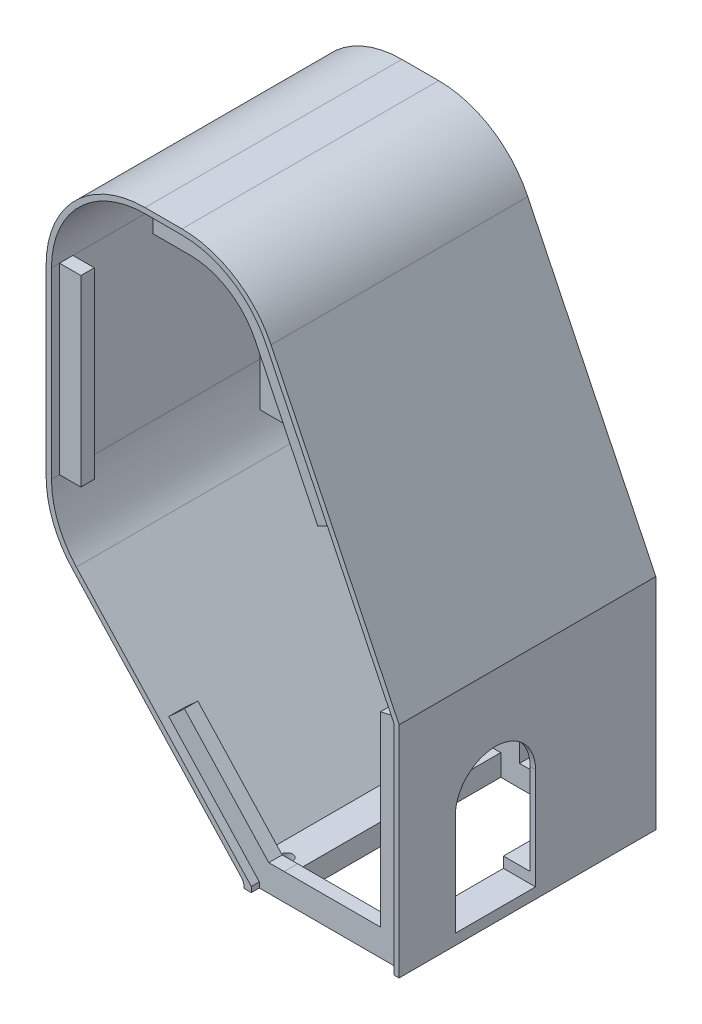
from build123d import *

# Parameters (mm, degrees)
EXTRUDE_1_DEPTH      = 6
FILLET_1_R           = 18.5
SKETCH_3_R           = 16.15
CUT_EXTRUDE_1_DEPTH  = 4.5
CUT_EXTRUDE_2_REACH  = 120.868
SKETCH_4_R           = 14.85
CHAMFER_1_SIZE       = 2.355852366
CHAMFER_1_SIZE_2     = 1
SKETCH_5_W           = 28
SKETCH_5_H           = 6
EXTRUDE_2_DEPTH      = 6.5
SKETCH_6_W           = 14.3
SKETCH_6_H           = 2.8
CUT_EXTRUDE_3_DEPTH  = 1.5
SKETCH_7_W           = 6.85
SKETCH_7_H           = 3
SKETCH_7_H_2         = 2.655811089
EXTRUDE_3_DEPTH      = 28
CUT_EXTRUDE_4_REACH  = 121.439
SKETCH_8_R           = 1.15
CUT_EXTRUDE_5_REACH  = 121.439
SKETCH_9_R           = 2.1
CUT_EXTRUDE_START    = -3
SKETCH_10_R          = 10.75
CUT_EXTRUDE_6_DEPTH  = 3
CUT_EXTRUDE_7_REACH  = 121.439
SKETCH_11_R          = 1.4
EXTRUDE_4_DEPTH      = 42
SKETCH_13_R          = 1.1
CUT_EXTRUDE_8_DEPTH  = 8
SKETCH_14_W          = 6
SKETCH_14_H          = 46
SKETCH_14_R          = 1.1
EXTRUDE_5_DEPTH      = 4
FILLET_2_R           = 2
CUT_EXTRUDE_10_REACH = 128.016
CUT_EXTRUDE_11_REACH = 130.115
EXTRUDE_START        = -1.5
SKETCH_17_W          = 5
SKETCH_17_H          = 34.255734548
EXTRUDE_6_DEPTH      = 2.5


with BuildPart() as part:
    # 스케치1 → 보스-돌출1 (new body)
    with BuildSketch(Plane.XY):
        Polygon((-65.949690405, 38.792569711), (-28.949690405, -1.207430289), (-28.949690405, -2.207430289), (0.050309595, -2.207430289), (0.050309595, -1.207430289), (0.050309595, 38.792569711), (-28.949690405, 98.792569711), (-65.949690405, 98.792569711), align=None)
    extrude(amount=-EXTRUDE_1_DEPTH)

    # 필렛1
    fillet_1_edges = [part.edges().sort_by_distance(p)[0] for p in [
        (-65.949690405, 98.792569711, -3),
        (-28.949690405, 98.792569711, -3),
        (-65.949690405, 38.792569711, -3),
    ]]
    fillet(fillet_1_edges, radius=FILLET_1_R)

    # 스케치3 → 컷-돌출1 (cut)
    with BuildSketch(Plane(origin=(0, 0, -6), x_dir=(-1, 0, 0), z_dir=(0, 0, -1))):
        with Locations((47.449690405, 80.292569711)):
            Circle(SKETCH_3_R)
    extrude(amount=-CUT_EXTRUDE_1_DEPTH, mode=Mode.SUBTRACT)

    # 스케치4 → 컷-돌출2 (cut, up to next)
    with BuildSketch(Plane(origin=(0, 0, -1.5), x_dir=(-1, 0, 0), z_dir=(0, 0, -1)), mode=Mode.PRIVATE) as cut_extrude_2_sk1:
        with Locations((47.449690405, 80.292569711)):
            Circle(SKETCH_4_R)
    cut_extrude_2_tool1 = extrude(cut_extrude_2_sk1.sketch, amount=-CUT_EXTRUDE_2_REACH, mode=Mode.PRIVATE) & part.part
    add(cut_extrude_2_tool1.solids().sort_by_distance((-47.44969, 80.29257, -1.5))[0], mode=Mode.SUBTRACT)

    # 모따기1
    # the kernel refuses this chamfer: 2.355852366, 1 mm, written as the material it takes off along each edge
    with BuildSketch(Plane(origin=(-47.449690405, 80.292569711, -6), x_dir=(-1, 0, 0), z_dir=(0, -1, 0))) as chamfer_1_piece_1:
        Polygon((16.15 + CHAMFER_1_SIZE, 0), (16.15, -CHAMFER_1_SIZE_2), (16.15, 0), align=None)
    revolve(axis=Axis((-47.449690405, 80.292569711, -6), (0, 0, -1)), mode=Mode.SUBTRACT)

    # 스케치5 → 보스-돌출2 (add)
    with BuildSketch(Plane.XY):
        with Locations((-47.449690405, 44.292569711)):
            Rectangle(SKETCH_5_W, SKETCH_5_H)
        with BuildLine():
            Line((-61.449690405, 67.292569711), (-58.404141555, 67.292569711))
            ThreePointArc((-58.404141555, 67.292569711), (-56.582644842, 65.954189634), (-54.599690405, 64.86929185))
            Line((-54.599690405, 64.86929185), (-54.599690405, 57.292569711))
            Line((-54.599690405, 57.292569711), (-61.449690405, 57.292569711))
            Line((-61.449690405, 57.292569711), (-61.449690405, 67.292569711))
        make_face()
        with BuildLine():
            Line((-33.449690405, 67.292569711), (-36.495239255, 67.292569711))
            ThreePointArc((-36.495239255, 67.292569711), (-38.316735967, 65.954189634), (-40.299690405, 64.86929185))
            Line((-40.299690405, 64.86929185), (-40.299690405, 57.292569711))
            Line((-40.299690405, 57.292569711), (-33.449690405, 57.292569711))
            Line((-33.449690405, 57.292569711), (-33.449690405, 67.292569711))
        make_face()
    extrude(amount=EXTRUDE_2_DEPTH)

    # 스케치6 → 컷-돌출3 (cut)
    with BuildSketch(Plane.XY.offset(6.5)):
        with Locations((-47.449690405, 45.892569711)):
            Rectangle(SKETCH_6_W, SKETCH_6_H)
    extrude(amount=-CUT_EXTRUDE_3_DEPTH, mode=Mode.SUBTRACT)

    # 스케치7 → 보스-돌출3 (add)
    with BuildSketch(Plane(origin=(0, 47.292569711, 0), x_dir=(1, 0, 0), z_dir=(0, 1, 0))):
        with Locations((-58.024690405, -5)):
            Rectangle(SKETCH_7_W, SKETCH_7_H)
        with Locations((-36.874690405, -5.172094455)):
            Rectangle(SKETCH_7_W, SKETCH_7_H_2)
    extrude(amount=EXTRUDE_3_DEPTH)

    # 스케치8 → 컷-돌출4 (cut, up to next)
    with BuildSketch(Plane.XY.offset(6.5), mode=Mode.PRIVATE) as cut_extrude_4_sk1:
        with Locations((-57.699690405, 71.792569711)):
            Circle(SKETCH_8_R)
    cut_extrude_4_tool1 = extrude(cut_extrude_4_sk1.sketch, amount=-CUT_EXTRUDE_4_REACH, mode=Mode.PRIVATE) & part.part
    # 스케치8 → 컷-돌출4 (cut, up to next)
    with BuildSketch(Plane.XY.offset(6.5), mode=Mode.PRIVATE) as cut_extrude_4_sk2:
        with Locations((-37.199690405, 71.792569711)):
            Circle(SKETCH_8_R)
    cut_extrude_4_tool2 = extrude(cut_extrude_4_sk2.sketch, amount=-CUT_EXTRUDE_4_REACH, mode=Mode.PRIVATE) & part.part
    # 스케치8 → 컷-돌출4 (cut, up to next)
    with BuildSketch(Plane.XY.offset(6.5), mode=Mode.PRIVATE) as cut_extrude_4_sk3:
        with Locations((-37.199690405, 51.292569711)):
            Circle(SKETCH_8_R)
    cut_extrude_4_tool3 = extrude(cut_extrude_4_sk3.sketch, amount=-CUT_EXTRUDE_4_REACH, mode=Mode.PRIVATE) & part.part
    # 스케치8 → 컷-돌출4 (cut, up to next)
    with BuildSketch(Plane.XY.offset(6.5), mode=Mode.PRIVATE) as cut_extrude_4_sk4:
        with Locations((-57.699690405, 51.292569711)):
            Circle(SKETCH_8_R)
    cut_extrude_4_tool4 = extrude(cut_extrude_4_sk4.sketch, amount=-CUT_EXTRUDE_4_REACH, mode=Mode.PRIVATE) & part.part
    add(cut_extrude_4_tool1.solids().sort_by_distance((-57.69969, 71.79257, 6.5))[0], mode=Mode.SUBTRACT)
    add(cut_extrude_4_tool2.solids().sort_by_distance((-37.19969, 71.79257, 6.5))[0], mode=Mode.SUBTRACT)
    add(cut_extrude_4_tool3.solids().sort_by_distance((-37.19969, 51.29257, 6.5))[0], mode=Mode.SUBTRACT)
    add(cut_extrude_4_tool4.solids().sort_by_distance((-57.69969, 51.29257, 6.5))[0], mode=Mode.SUBTRACT)

    # 스케치9 → 컷-돌출5 (cut, up to next)
    with BuildSketch(Plane(origin=(0, 0, -6), x_dir=(-1, 0, 0), z_dir=(0, 0, -1)), mode=Mode.PRIVATE) as cut_extrude_5_sk1:
        with Locations((57.699690405, 51.292569711)):
            Circle(SKETCH_9_R)
    cut_extrude_5_tool1 = extrude(cut_extrude_5_sk1.sketch, amount=-CUT_EXTRUDE_5_REACH, mode=Mode.PRIVATE) & part.part
    # 스케치9 → 컷-돌출5 (cut, up to next)
    with BuildSketch(Plane(origin=(0, 0, -6), x_dir=(-1, 0, 0), z_dir=(0, 0, -1)), mode=Mode.PRIVATE) as cut_extrude_5_sk2:
        with Locations((37.199690405, 51.292569711)):
            Circle(SKETCH_9_R)
    cut_extrude_5_tool2 = extrude(cut_extrude_5_sk2.sketch, amount=-CUT_EXTRUDE_5_REACH, mode=Mode.PRIVATE) & part.part
    add(cut_extrude_5_tool1.solids().sort_by_distance((-57.69969, 51.29257, -6))[0], mode=Mode.SUBTRACT)
    add(cut_extrude_5_tool2.solids().sort_by_distance((-37.19969, 51.29257, -6))[0], mode=Mode.SUBTRACT)

    # 스케치10 → 컷-돌출6 (cut)
    with BuildSketch(Plane.XY.offset(6.5).offset(CUT_EXTRUDE_START)):
        with Locations((-47.449690405, 80.292569711)):
            Circle(SKETCH_10_R)
    extrude(amount=CUT_EXTRUDE_6_DEPTH, mode=Mode.SUBTRACT)

    # 스케치11 → 컷-돌출7 (cut, up to next)
    with BuildSketch(Plane(origin=(0, 0, -6), x_dir=(-1, 0, 0), z_dir=(0, 0, -1)), mode=Mode.PRIVATE) as cut_extrude_7_sk1:
        with Locations((9.949690405, 36.792569711)):
            Circle(SKETCH_11_R)
    cut_extrude_7_tool1 = extrude(cut_extrude_7_sk1.sketch, amount=-CUT_EXTRUDE_7_REACH, mode=Mode.PRIVATE) & part.part
    # 스케치11 → 컷-돌출7 (cut, up to next)
    with BuildSketch(Plane(origin=(0, 0, -6), x_dir=(-1, 0, 0), z_dir=(0, 0, -1)), mode=Mode.PRIVATE) as cut_extrude_7_sk2:
        with Locations((26.949690405, 26.792569711)):
            Circle(SKETCH_11_R)
    cut_extrude_7_tool2 = extrude(cut_extrude_7_sk2.sketch, amount=-CUT_EXTRUDE_7_REACH, mode=Mode.PRIVATE) & part.part
    # 스케치11 → 컷-돌출7 (cut, up to next)
    with BuildSketch(Plane(origin=(0, 0, -6), x_dir=(-1, 0, 0), z_dir=(0, 0, -1)), mode=Mode.PRIVATE) as cut_extrude_7_sk3:
        with Locations((26.949690405, 6.792569711)):
            Circle(SKETCH_11_R)
    cut_extrude_7_tool3 = extrude(cut_extrude_7_sk3.sketch, amount=-CUT_EXTRUDE_7_REACH, mode=Mode.PRIVATE) & part.part
    # 스케치11 → 컷-돌출7 (cut, up to next)
    with BuildSketch(Plane(origin=(0, 0, -6), x_dir=(-1, 0, 0), z_dir=(0, 0, -1)), mode=Mode.PRIVATE) as cut_extrude_7_sk4:
        with Locations((54.949690405, 36.792569711)):
            Circle(SKETCH_11_R)
    cut_extrude_7_tool4 = extrude(cut_extrude_7_sk4.sketch, amount=-CUT_EXTRUDE_7_REACH, mode=Mode.PRIVATE) & part.part
    add(cut_extrude_7_tool1.solids().sort_by_distance((-9.94969, 36.79257, -6))[0], mode=Mode.SUBTRACT)
    add(cut_extrude_7_tool2.solids().sort_by_distance((-26.94969, 26.79257, -6))[0], mode=Mode.SUBTRACT)
    add(cut_extrude_7_tool3.solids().sort_by_distance((-26.94969, 6.79257, -6))[0], mode=Mode.SUBTRACT)
    add(cut_extrude_7_tool4.solids().sort_by_distance((-54.94969, 36.79257, -6))[0], mode=Mode.SUBTRACT)

    # 스케치12 → 보스-돌출4 (add)
    with BuildSketch(Plane.XY):
        with BuildLine():
            Line((-0.949690405, -2.207430289), (-0.949690405, 38.563575631))
            Line((-0.949690405, 38.563575631), (-24.799505797, 87.908021271))
            ThreePointArc((-24.799505797, 87.908021271), (-31.255623286, 95.116880864), (-40.555612472, 97.792569711))
            Line((-40.555612472, 97.792569711), (-47.449690405, 97.792569711))
            ThreePointArc((-47.449690405, 97.792569711), (-59.824059075, 92.666938382), (-64.949690405, 80.292569711))
            Line((-64.949690405, 80.292569711), (-64.949690405, 46.036835163))
            ThreePointArc((-64.949690405, 46.036835163), (-63.744903711, 39.65592431), (-60.296430597, 34.153600485))
            Line((-60.296430597, 34.153600485), (-27.587477132, -1.207430289))
            Line((-27.587477132, -1.207430289), (-27.587477132, -2.207430289))
            Line((-27.587477132, -2.207430289), (-28.949690405, -2.207430289))
            Line((-28.949690405, -2.207430289), (-28.949690405, -1.207430289))
            Line((-28.949690405, -1.207430289), (-61.030530037, 33.474558503))
            ThreePointArc((-61.030530037, 33.474558503), (-64.676058757, 39.291300833), (-65.949690405, 46.036835163))
            Line((-65.949690405, 46.036835163), (-65.949690405, 80.292569711))
            ThreePointArc((-65.949690405, 80.292569711), (-60.531165857, 93.374045163), (-47.449690405, 98.792569711))
            Line((-47.449690405, 98.792569711), (-40.555612472, 98.792569711))
            ThreePointArc((-40.555612472, 98.792569711), (-30.724195333, 95.963984358), (-23.899156844, 88.343189931))
            Line((-23.899156844, 88.343189931), (0.050309595, 38.792569711))
            Line((0.050309595, 38.792569711), (0.050309595, -1.207430289))
            Line((0.050309595, -1.207430289), (0.050309595, -2.207430289))
            Line((0.050309595, -2.207430289), (-0.949690405, -2.207430289))
        make_face()
    extrude(amount=EXTRUDE_4_DEPTH)

    # 스케치13 → 컷-돌출8 (cut)
    with BuildSketch(Plane.XZ.offset(2.207430289)):
        with Locations(Location((-14.449690405, -3, 0), (0, 0, 270))):
            Circle(SKETCH_13_R)
    extrude(amount=-CUT_EXTRUDE_8_DEPTH, mode=Mode.SUBTRACT)

    # 스케치14 → 보스-돌출5 (add)
    # profile 1 of 2: a face of its own
    with BuildSketch(Plane.XZ.offset(2.207430289)):
        with Locations((-25.949690405, 17)):
            Rectangle(SKETCH_14_W, SKETCH_14_H)
        with Locations(Location((-25.949690405, 37, 0), (0, 0, 270))):
            Circle(SKETCH_14_R, mode=Mode.SUBTRACT)
        with Locations(Location((-25.949690405, 12, 0), (0, 0, 270))):
            Circle(SKETCH_14_R, mode=Mode.SUBTRACT)
    # profile 2 of 2: a face of its own
    with BuildSketch(Plane.XZ.offset(2.207430289)):
        with Locations((-2.949690405, 17)):
            Rectangle(SKETCH_14_W, SKETCH_14_H)
        with Locations(Location((-2.949690405, 37, 0), (0, 0, 270))):
            Circle(SKETCH_14_R, mode=Mode.SUBTRACT)
        with Locations(Location((-2.949690405, 12, 0), (0, 0, 270))):
            Circle(SKETCH_14_R, mode=Mode.SUBTRACT)
    extrude(amount=-EXTRUDE_5_DEPTH)

    # 필렛2
    fillet_2_edges = [part.edges().sort_by_distance(p)[0] for p in [
        (-28.949690405, -1.207430289, 18),
    ]]
    fillet(fillet_2_edges, radius=FILLET_2_R)

    # 스케치15 → 컷-돌출10 (cut, up to next)
    with BuildSketch(Plane(origin=(0.050309595, 0, 0), x_dir=(0, 0, -1), z_dir=(1, 0, 0)), mode=Mode.PRIVATE) as cut_extrude_10_sk1:
        with BuildLine():
            Line((-16.5, 18.792569711), (-16.5, -0.207430289))
            Line((-16.5, -0.207430289), (-31.5, -0.207430289))
            Line((-31.5, -0.207430289), (-31.5, 18.792569711))
            ThreePointArc((-31.5, 18.792569711), (-24, 26.292569711), (-16.5, 18.792569711))
        make_face()
    cut_extrude_10_tool1 = extrude(cut_extrude_10_sk1.sketch, amount=-CUT_EXTRUDE_10_REACH, mode=Mode.PRIVATE) & part.part
    add(cut_extrude_10_tool1.solids().sort_by_distance((0.05031, 12.294103, 24))[0], mode=Mode.SUBTRACT)

    # 스케치16 → 컷-돌출11 (cut, up to next)
    with BuildSketch(Plane(origin=(0, 0, -6), x_dir=(-1, 0, 0), z_dir=(0, 0, -1)), mode=Mode.PRIVATE) as cut_extrude_11_sk1:
        with BuildLine():
            Line((4.449690405, 18.792569711), (4.449690405, 1.792569711))
            Line((4.449690405, 1.792569711), (19.449690405, 1.792569711))
            Line((19.449690405, 1.792569711), (19.449690405, 18.792569711))
            ThreePointArc((19.449690405, 18.792569711), (11.949690405, 26.292569711), (4.449690405, 18.792569711))
        make_face()
    cut_extrude_11_tool1 = extrude(cut_extrude_11_sk1.sketch, amount=-CUT_EXTRUDE_11_REACH, mode=Mode.PRIVATE) & part.part
    add(cut_extrude_11_tool1.solids().sort_by_distance((-11.94969, 13.299021, -6))[0], mode=Mode.SUBTRACT)

    # 스케치17 → 보스-돌출6 (add)
    with BuildSketch(Plane.XY.offset(42).offset(EXTRUDE_START)):
        with BuildLine():
            Line((-5.949690405, 2.792569711), (-4.949690405, 2.792569711))
            Line((-4.949690405, 2.792569711), (-4.949690405, 37.64759931))
            Line((-4.949690405, 37.64759931), (0.050309595, 38.792569711))
            Line((0.050309595, 38.792569711), (0.050309595, -2.207430289))
            Line((0.050309595, -2.207430289), (-0.949690405, -2.207430289))
            Line((-0.949690405, -2.207430289), (-5.949690405, -2.207430289))
            Line((-5.949690405, -2.207430289), (-22.949690405, -2.207430289))
            Line((-22.949690405, -2.207430289), (-27.587477132, -2.207430289))
            Line((-27.587477132, -2.207430289), (-28.949690405, -2.207430289))
            Line((-28.949690405, -2.207430289), (-28.949690405, -1.990594121))
            ThreePointArc((-28.949690405, -1.990594121), (-29.087380313, -1.261347167), (-29.481491525, -0.632510158))
            Line((-29.481491525, -0.632510158), (-45.256010781, 16.421024173))
            Line((-45.256010781, 16.421024173), (-41.590694155, 19.825568444))
            Line((-41.590694155, 19.825568444), (-25.82135547, 2.781368476))
            Line((-25.82135547, 2.781368476), (-22.949690405, 2.792569711))
            Line((-22.949690405, 2.792569711), (-5.949690405, 2.792569711))
        make_face()
        with Locations((-63.449690405, 63.164702437)):
            Rectangle(SKETCH_17_W, SKETCH_17_H)
        with BuildLine():
            Line((-16.675296007, 61.90747297), (-28.400901609, 86.167346629))
            ThreePointArc((-28.400901609, 86.167346629), (-33.3813351, 91.728466886), (-40.555612472, 93.792569711))
            Line((-40.555612472, 93.792569711), (-47.449690405, 93.792569711))
            Line((-47.449690405, 93.792569711), (-47.449690405, 98.792569711))
            Line((-47.449690405, 98.792569711), (-40.555612472, 98.792569711))
            ThreePointArc((-40.555612472, 98.792569711), (-30.724195333, 95.963984358), (-23.899156844, 88.343189931))
            Line((-23.899156844, 88.343189931), (-12.173551242, 64.083316272))
            Line((-12.173551242, 64.083316272), (-16.675296007, 61.90747297))
        make_face()
    extrude(amount=-EXTRUDE_6_DEPTH)


solid = part.part
